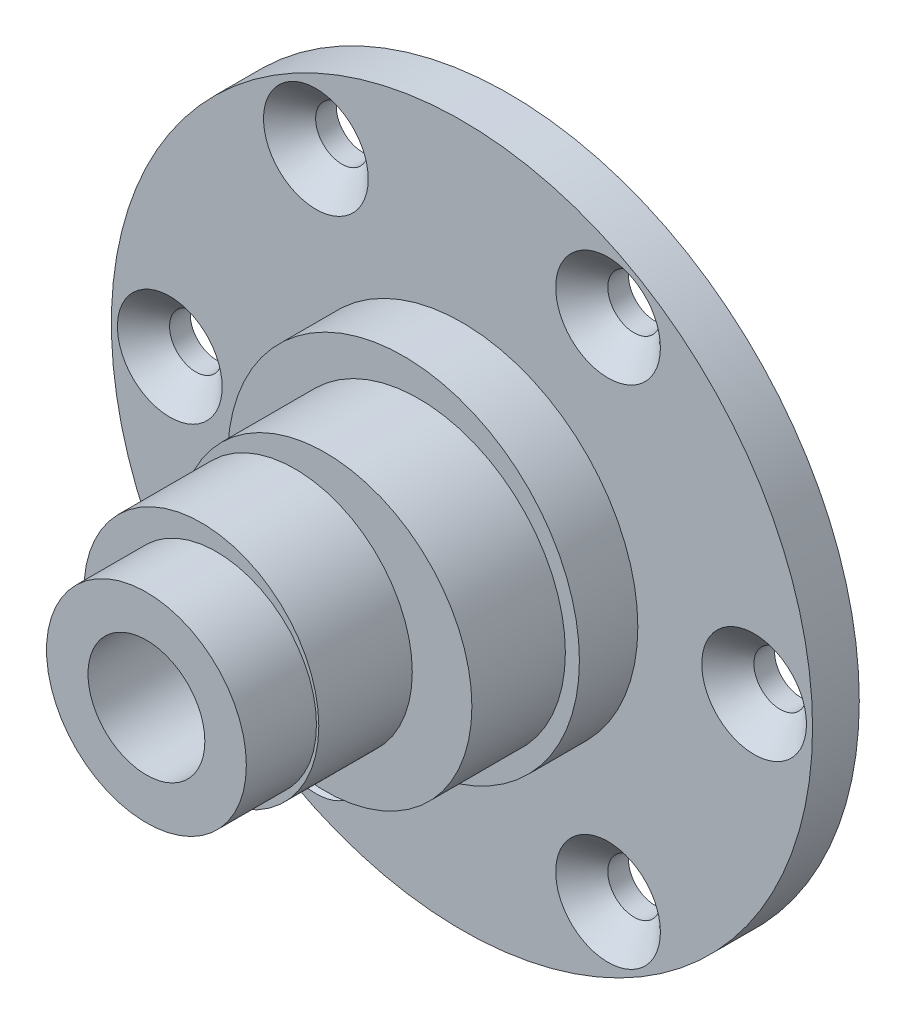
from build123d import *

# Parameters (mm, degrees)
SKETCH1_R                                    = 30
BOSS_EXTRUDE1_DEPTH                          = 4
CSK_FOR_M4_HEX_SOCKET_COUNTERSUNK_CA_2_COUNT = 2
CSK_FOR_M4_HEX_SOCKET_COUNTERSUNK_CA_2_PITCH = 25
CSK_FOR_M4_HEX_SOCKET_COUNTERSUNK_CA_3_COUNT = 2
CSK_FOR_M4_HEX_SOCKET_COUNTERSUNK_CA_3_PITCH = 43.301270189
CSK_FOR_M4_HEX_SOCKET_COUNTERSUNK_CA_4_COUNT = 2
CSK_FOR_M4_HEX_SOCKET_COUNTERSUNK_CA_4_PITCH = 43.301270189
CSK_FOR_M4_HEX_SOCKET_COUNTERSUNK_CA_5_COUNT = 2
CSK_FOR_M4_HEX_SOCKET_COUNTERSUNK_CA_5_PITCH = 50
CSK_FOR_M4_HEX_SOCKET_COUNTERSUNK_CA_6_COUNT = 2
CSK_FOR_M4_HEX_SOCKET_COUNTERSUNK_CA_6_PITCH = 25
SKETCH2_R                                    = 15.05
SKETCH2_R_2                                  = 10.05
BOSS_EXTRUDE3_DEPTH                          = 5
SKETCH5_R                                    = 12
CUT_EXTRUDE2_DEPTH                           = 4
SKETCH6_R                                    = 12.55
BOSS_EXTRUDE4_DEPTH                          = 8
SKETCH7_R                                    = 10.05
BOSS_EXTRUDE5_DEPTH                          = 8
SKETCH8_R                                    = 8.55
BOSS_EXTRUDE6_DEPTH                          = 6
SKETCH9_R                                    = 5
CUT_EXTRUDE3_DEPTH                           = 30


with BuildPart() as part:
    # Sketch1 → Boss-Extrude1 (new body)
    with BuildSketch(Plane.XY):
        Circle(SKETCH1_R)
    extrude(amount=BOSS_EXTRUDE1_DEPTH)

    # Sketch3 → CSK for M4 Hex Socket Countersunk Cap Screw1 (revolve, cut)
    with BuildSketch(Plane(origin=(-12.5, 21.650635095, 4), x_dir=(0, -1, 0), z_dir=(1, 0, 0))):
        Polygon((0, 0), (0, 4), (2.25, 4), (2.25, 2.23), (4.48, 0), align=None)
    csk_for_m4_hex_socket_countersunk_cap_sc = revolve(axis=Axis((-12.5, 21.650635095, 10.35), (0, 0, -1)), mode=Mode.SUBTRACT)

    # CSK for M4 Hex Socket Countersunk Ca 2: CSK for M4 Hex Socket Countersunk Cap Screw1 ×2
    with Locations(*[(i * CSK_FOR_M4_HEX_SOCKET_COUNTERSUNK_CA_2_PITCH, 0, 0) for i in range(1, CSK_FOR_M4_HEX_SOCKET_COUNTERSUNK_CA_2_COUNT)]):
        add(csk_for_m4_hex_socket_countersunk_cap_sc, mode=Mode.SUBTRACT)

    # CSK for M4 Hex Socket Countersunk Ca 3: CSK for M4 Hex Socket Countersunk Cap Screw1 ×2
    with Locations(*[Vector(0.8660254037844606, -0.4999999999999621, 0) * (i * CSK_FOR_M4_HEX_SOCKET_COUNTERSUNK_CA_3_PITCH) for i in range(1, CSK_FOR_M4_HEX_SOCKET_COUNTERSUNK_CA_3_COUNT)]):
        add(csk_for_m4_hex_socket_countersunk_cap_sc, mode=Mode.SUBTRACT)

    # CSK for M4 Hex Socket Countersunk Ca 4: CSK for M4 Hex Socket Countersunk Cap Screw1 ×2
    with Locations(*[(0, -i * CSK_FOR_M4_HEX_SOCKET_COUNTERSUNK_CA_4_PITCH, 0) for i in range(1, CSK_FOR_M4_HEX_SOCKET_COUNTERSUNK_CA_4_COUNT)]):
        add(csk_for_m4_hex_socket_countersunk_cap_sc, mode=Mode.SUBTRACT)

    # CSK for M4 Hex Socket Countersunk Ca 5: CSK for M4 Hex Socket Countersunk Cap Screw1 ×2
    with Locations(*[Vector(0.5000000000000379, -0.8660254037844168, 0) * (i * CSK_FOR_M4_HEX_SOCKET_COUNTERSUNK_CA_5_PITCH) for i in range(1, CSK_FOR_M4_HEX_SOCKET_COUNTERSUNK_CA_5_COUNT)]):
        add(csk_for_m4_hex_socket_countersunk_cap_sc, mode=Mode.SUBTRACT)

    # CSK for M4 Hex Socket Countersunk Ca 6: CSK for M4 Hex Socket Countersunk Cap Screw1 ×2
    with Locations(*[Vector(-0.49999999999996236, -0.8660254037844605, 0) * (i * CSK_FOR_M4_HEX_SOCKET_COUNTERSUNK_CA_6_PITCH) for i in range(1, CSK_FOR_M4_HEX_SOCKET_COUNTERSUNK_CA_6_COUNT)]):
        add(csk_for_m4_hex_socket_countersunk_cap_sc, mode=Mode.SUBTRACT)

    # Sketch2 → Boss-Extrude3 (add)
    with BuildSketch(Plane.XY.offset(4)):
        Circle(SKETCH2_R)
        Circle(SKETCH2_R_2, mode=Mode.SUBTRACT)
    extrude(amount=BOSS_EXTRUDE3_DEPTH)

    # Sketch5 → Cut-Extrude2 (cut)
    with BuildSketch(Plane(origin=(0, 0, 0), x_dir=(-1, 0, 0), z_dir=(0, 0, -1))):
        Circle(SKETCH5_R)
    extrude(amount=-CUT_EXTRUDE2_DEPTH, mode=Mode.SUBTRACT)

    # Sketch6 → Boss-Extrude4 (add)
    with BuildSketch(Plane.XY.offset(9)):
        with Locations((1.3, 0)):
            Circle(SKETCH6_R)
    extrude(amount=BOSS_EXTRUDE4_DEPTH)

    # Sketch7 → Boss-Extrude5 (add)
    with BuildSketch(Plane.XY.offset(17)):
        with Locations((-1.3, 0)):
            Circle(SKETCH7_R)
    extrude(amount=BOSS_EXTRUDE5_DEPTH)

    # Sketch8 → Boss-Extrude6 (add)
    with BuildSketch(Plane.XY.offset(25)):
        Circle(SKETCH8_R)
    extrude(amount=BOSS_EXTRUDE6_DEPTH)

    # Sketch9 → Cut-Extrude3 (cut)
    with BuildSketch(Plane.XY.offset(31)):
        Circle(SKETCH9_R)
    extrude(amount=-CUT_EXTRUDE3_DEPTH, mode=Mode.SUBTRACT)


solid = part.part
